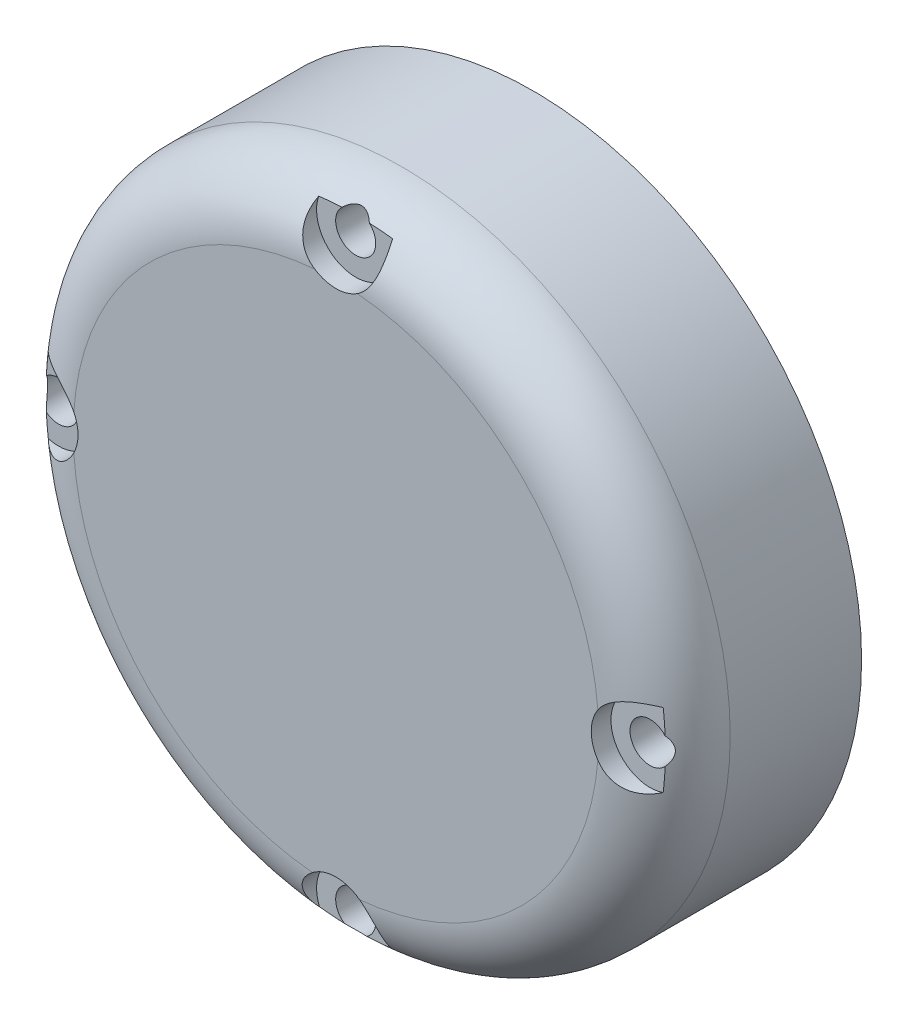
from build123d import *

# Parameters (mm, degrees)
SKETCH1_R                                           = 25
SKETCH1_R_2                                         = 19
BOSS_EXTRUDE1_DEPTH                                 = 5
SKETCH2_R                                           = 25
BOSS_EXTRUDE2_DEPTH                                 = 10
FILLET1_R                                           = 5
CBORE_FOR_3_BINDING_HEAD_MACHINE_SCREW1_D           = 3.048
CBORE_FOR_3_BINDING_HEAD_MACHINE_SCREW1_CBORE_D     = 5.95376
CBORE_FOR_3_BINDING_HEAD_MACHINE_SCREW1_CBORE_DEPTH = 1.4986


with BuildPart() as part:
    # Sketch1 → Boss-Extrude1 (new body)
    with BuildSketch(Plane.XY):
        Circle(SKETCH1_R)
        Circle(SKETCH1_R_2, mode=Mode.SUBTRACT)
    extrude(amount=BOSS_EXTRUDE1_DEPTH)

    # Sketch2 → Boss-Extrude2 (add)
    with BuildSketch(Plane.XY.offset(5)):
        Circle(SKETCH2_R)
    extrude(amount=BOSS_EXTRUDE2_DEPTH)

    # Fillet1
    fillet1_edges = [part.edges().sort_by_distance(p)[0] for p in [
        (-25, 0, 15),
        (-19, 0, 5),
    ]]
    fillet(fillet1_edges, radius=FILLET1_R - 0.0001)  # a hair under: the kernel refuses the full size

    # CBORE for #3 Binding Head Machine Screw1 (through all)
    with Locations(Plane.XY.offset(15)):
        with Locations((0, 22.435050854), (0, -22.295918756), (22.400267829, 0), (-22.608965977, 0)):
            CounterBoreHole(CBORE_FOR_3_BINDING_HEAD_MACHINE_SCREW1_D / 2, CBORE_FOR_3_BINDING_HEAD_MACHINE_SCREW1_CBORE_D / 2, CBORE_FOR_3_BINDING_HEAD_MACHINE_SCREW1_CBORE_DEPTH)


solid = part.part
